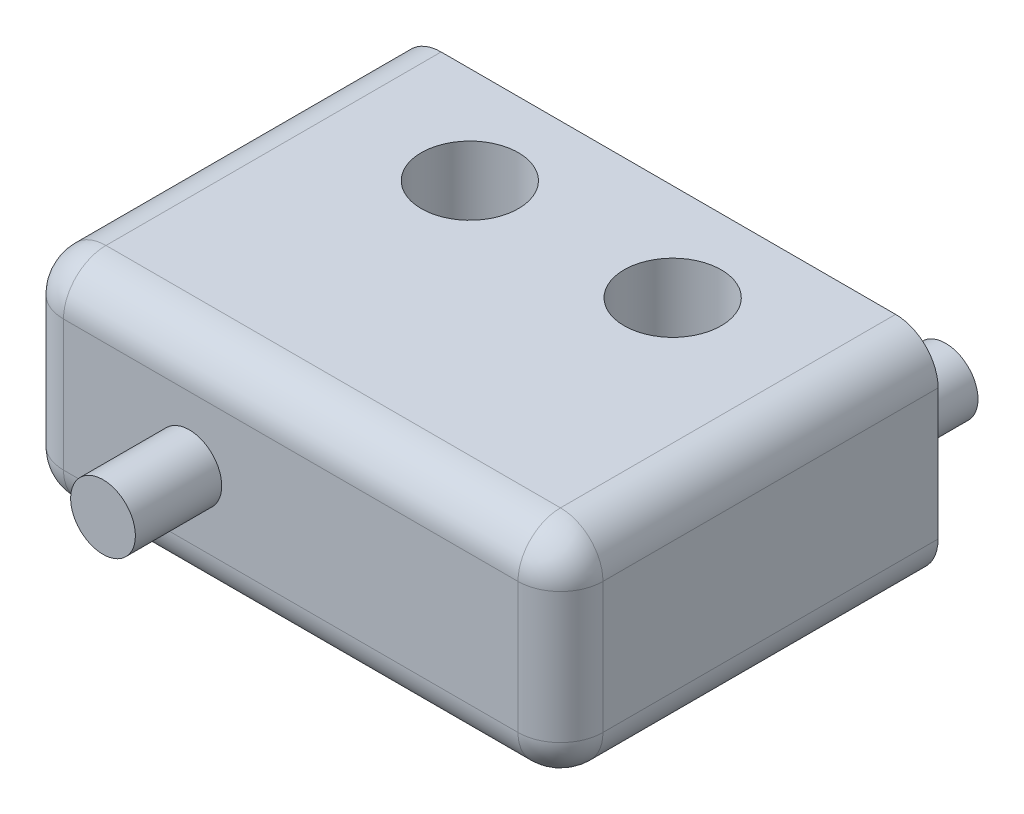
from build123d import *

# Parameters (mm, degrees)
SKETCH_1_W          = 12.7
SKETCH_1_H          = 5.08
EXTRUDE_1_DEPTH     = 8.89
SKETCH_2_R          = 0.762
EXTRUDE_2_DEPTH     = 1.778
SKETCH_3_R          = 0.762
EXTRUDE_3_DEPTH     = 2.032
FILLET_2_R          = 1
FILLET_3_R          = 1
SKETCH_4_R          = 1.143
CUT_EXTRUDE_1_DEPTH = 6


with BuildPart() as part:
    # Эскиз1 → Бобышка-Вытянуть1 (new body)
    with BuildSketch(Plane.XY):
        Rectangle(SKETCH_1_W, SKETCH_1_H)
    extrude(amount=EXTRUDE_1_DEPTH)

    # Эскиз2 → Бобышка-Вытянуть2 (add)
    with BuildSketch(Plane(origin=(0, 0, 0), x_dir=(-1, 0, 0), z_dir=(0, 0, -1))):
        with Locations(Location((-4.7498, 0, 0), (0, 0, 180))):
            Circle(SKETCH_2_R)
        with Locations(Location((0, 0, 0), (0, 0, 180))):
            Circle(SKETCH_2_R)
        with Locations(Location((4.7498, 0, 0), (0, 0, 180))):
            Circle(SKETCH_2_R)
    extrude(amount=EXTRUDE_2_DEPTH)

    # Эскиз3 → Бобышка-Вытянуть3 (add)
    with BuildSketch(Plane.XY.offset(8.89)):
        with Locations((-2.3876, 0)):
            Circle(SKETCH_3_R)
    extrude(amount=EXTRUDE_3_DEPTH)

    # Скругление2
    fillet_2_edges = [part.edges().sort_by_distance(p)[0] for p in [
        (-6.35, 0, 8.89),
        (0, -2.54, 8.89),
        (6.35, 0, 8.89),
        (0, 2.54, 8.89),
    ]]
    fillet(fillet_2_edges, radius=FILLET_2_R)

    # Скругление3
    # the kernel refuses this fillet: 1 mm, written as the material it takes off along each edge
    with BuildSketch(Plane(origin=(5.35, 1.54, 7.89), x_dir=(1, 0, 0), z_dir=(0, 1, 0))) as fillet_3_piece_1_section:
        Polygon((0, 0), (FILLET_3_R, 0), (FILLET_3_R, -FILLET_3_R), (0, -FILLET_3_R), align=None)
    fillet_3_piece_1 = extrude(amount=FILLET_3_R, mode=Mode.PRIVATE)
    fillet_3_piece_1 = fillet_3_piece_1 - Plane(origin=(5.35, 1.54, 7.89), x_dir=(-0.7071067811865475, 0, -0.7071067811865475), z_dir=(0, 1, 0)) * Sphere(FILLET_3_R, mode=Mode.PRIVATE)
    add(fillet_3_piece_1, mode=Mode.SUBTRACT)
    with BuildSketch(Plane(origin=(5.35, -1.54, 7.89), x_dir=(0, -1, 0), z_dir=(1, 0, 0))) as fillet_3_piece_2_section:
        Polygon((0, 0), (FILLET_3_R, 0), (FILLET_3_R, -FILLET_3_R), (0, -FILLET_3_R), align=None)
    fillet_3_piece_2 = extrude(amount=FILLET_3_R, mode=Mode.PRIVATE)
    fillet_3_piece_2 = fillet_3_piece_2 - Plane(origin=(5.35, -1.54, 7.89), x_dir=(0, 0.7071067811865475, -0.7071067811865475), z_dir=(1, 0, 0)) * Sphere(FILLET_3_R, mode=Mode.PRIVATE)
    add(fillet_3_piece_2, mode=Mode.SUBTRACT)
    with BuildSketch(Plane(origin=(-5.35, 1.54, 7.89), x_dir=(-1, 0, 0), z_dir=(0, 1, 0))) as fillet_3_piece_3_section:
        Polygon((0, 0), (FILLET_3_R, 0), (FILLET_3_R, FILLET_3_R), (0, FILLET_3_R), align=None)
    fillet_3_piece_3 = extrude(amount=FILLET_3_R, mode=Mode.PRIVATE)
    fillet_3_piece_3 = fillet_3_piece_3 - Plane(origin=(-5.35, 1.54, 7.89), x_dir=(0.7071067811865475, 0, -0.7071067811865475), z_dir=(0, 1, 0)) * Sphere(FILLET_3_R, mode=Mode.PRIVATE)
    add(fillet_3_piece_3, mode=Mode.SUBTRACT)
    with BuildSketch(Plane(origin=(-5.35, -1.54, 7.89), x_dir=(0, -1, 0), z_dir=(-1, 0, 0))) as fillet_3_piece_4_section:
        Polygon((0, 0), (FILLET_3_R, 0), (FILLET_3_R, FILLET_3_R), (0, FILLET_3_R), align=None)
    fillet_3_piece_4 = extrude(amount=FILLET_3_R, mode=Mode.PRIVATE)
    fillet_3_piece_4 = fillet_3_piece_4 - Plane(origin=(-5.35, -1.54, 7.89), x_dir=(0, 0.7071067811865475, -0.7071067811865475), z_dir=(-1, 0, 0)) * Sphere(FILLET_3_R, mode=Mode.PRIVATE)
    add(fillet_3_piece_4, mode=Mode.SUBTRACT)
    with BuildSketch(Plane(origin=(-6.35, -2.54, -2.5), x_dir=(0, 1, 0), z_dir=(0, 0, 1)), Plane(origin=(-6.35, 2.54, -2.5), x_dir=(1, 0, 0), z_dir=(0, 0, 1))) as fillet_3_piece_5:
        with BuildLine():
            CenterArc((FILLET_3_R, -FILLET_3_R), FILLET_3_R, 90, 90)
            Line((0, -FILLET_3_R), (0, 0))
            Line((0, 0), (FILLET_3_R, 0))
        make_face()
    extrude(amount=10.39, mode=Mode.SUBTRACT)
    with BuildSketch(Plane(origin=(6.35, -2.54, -2.5), x_dir=(0, 1, 0), z_dir=(0, 0, 1)), Plane(origin=(6.35, 2.54, -2.5), x_dir=(-1, 0, 0), z_dir=(0, 0, 1))) as fillet_3_piece_6:
        with BuildLine():
            CenterArc((FILLET_3_R, FILLET_3_R), FILLET_3_R, 180, 90)
            Line((0, FILLET_3_R), (0, 0))
            Line((0, 0), (FILLET_3_R, 0))
        make_face()
    extrude(amount=10.39, mode=Mode.SUBTRACT)

    # Эскиз4 → Вырез-Вытянуть1 (cut)
    with BuildSketch(Plane(origin=(0, 2.54, 0), x_dir=(1, 0, 0), z_dir=(0, 1, 0))):
        with Locations(Location((-2.3876, -2.286, 0), (0, 0, 270))):
            Circle(SKETCH_4_R)
        with Locations(Location((2.3876, -2.286, 0), (0, 0, 270))):
            Circle(SKETCH_4_R)
    extrude(amount=-CUT_EXTRUDE_1_DEPTH, mode=Mode.SUBTRACT)


solid = part.part
